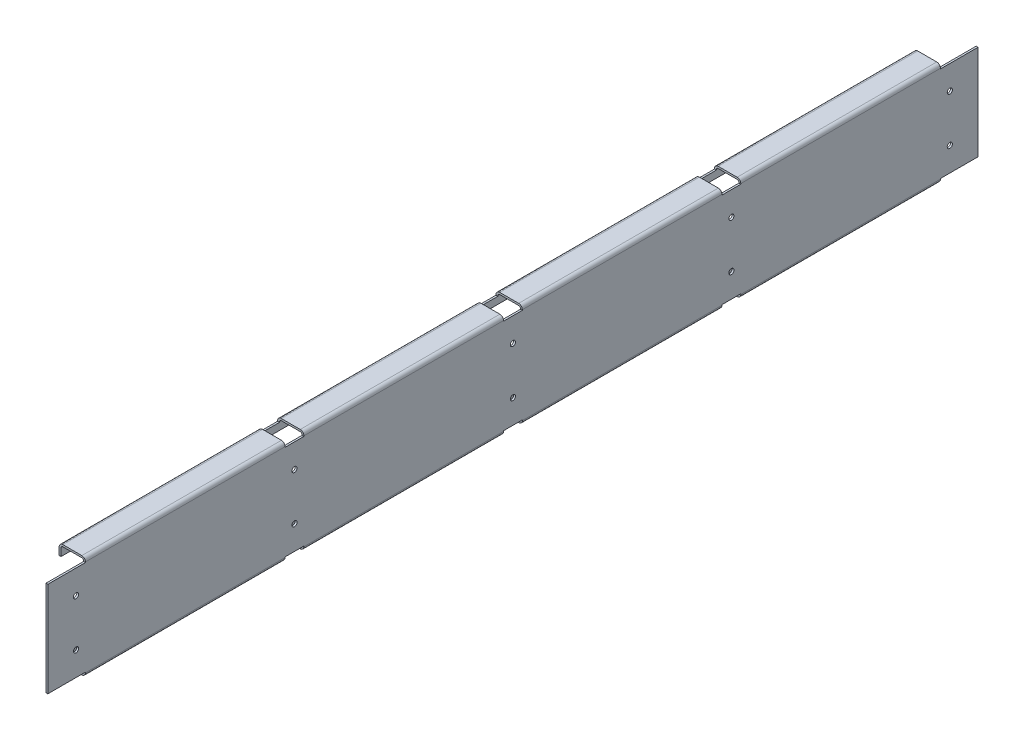
from build123d import *

# Parameters (mm, degrees)
BASE_FLANGE1_DEPTH      = 495
SKETCH6_W               = 30.5
SKETCH6_H               = 20
CUT_EXTRUDE1_DEPTH      = 4.5
LPATTERN1_COUNT         = 3
LPATTERN1_PITCH         = 232.5
LPATTERN1_COL_COUNT     = 3
LPATTERN1_COL_PITCH     = 232.5
MIRROR1_COPY_1_SKETCH_W = 30.5
MIRROR1_COPY_1_SKETCH_H = 20
MIRROR1_COPY_1_DEPTH    = 4.5
MIRROR1_COPY_2_SKETCH_W = 30.5
MIRROR1_COPY_2_SKETCH_H = 20
MIRROR1_COPY_2_DEPTH    = 4.5
MIRROR1_COPY_3_SKETCH_W = 30.5
MIRROR1_COPY_3_SKETCH_H = 20
MIRROR1_COPY_3_DEPTH    = 4.5
MIRROR1_COPY_4_SKETCH_W = 30.5
MIRROR1_COPY_4_SKETCH_H = 20
MIRROR1_COPY_4_DEPTH    = 4.5
CUT_EXTRUDE2_START      = -26
SKETCH7_W               = 40
SKETCH7_H               = 110
CUT_EXTRUDE2_DEPTH      = 26
SKETCH8_W               = 28.862585434
SKETCH8_H               = 32.444228354
SKETCH8_W_2             = 23.227575409
SKETCH8_H_2             = 8.085236505
CUT_EXTRUDE3_DEPTH      = 4.5
CUT_EXTRUDE4_START      = -26
SKETCH9_W               = 93.672664124
SKETCH9_H               = 132.08314216
CUT_EXTRUDE4_DEPTH      = 26
SKETCH10_W              = 25.364032915
SKETCH10_H              = 10.922603619
SKETCH10_W_2            = 22.654683255
SKETCH10_H_2            = 8.37911004
CUT_EXTRUDE5_DEPTH      = 4.5
SKETCH11_R              = 2.75
CUT_EXTRUDE6_DEPTH      = 499.832637264
LPATTERN2_COUNT         = 3
LPATTERN2_PITCH         = 232.5
LPATTERN2_COL_COUNT     = 3
LPATTERN2_COL_PITCH     = 232.5


# Sheet-metal steps are written as plain solids
with BuildPart() as part:
    # Sketch1 → Base-Flange1 (new, symmetric)
    with BuildSketch(Plane.XY):
        with BuildLine():
            Line((-28, -43), (-28, -51.1))
            ThreePointArc((-28, -51.1), (-26.857716447, -53.857716447), (-24.1, -55))
            Line((-24.1, -55), (-3.9, -55))
            ThreePointArc((-3.9, -55), (-1.142283553, -53.857716447), (0, -51.1))
            Line((0, -51.1), (0, 51.1))
            ThreePointArc((0, 51.1), (-1.142283553, 53.857716447), (-3.9, 55))
            Line((-3.9, 55), (-24.1, 55))
            ThreePointArc((-24.1, 55), (-26.857716447, 53.857716447), (-28, 51.1))
            Line((-28, 51.1), (-28, 43))
            Line((-28, 43), (-26, 43))
            Line((-26, 43), (-26, 51.1))
            ThreePointArc((-26, 51.1), (-25.443502884, 52.443502884), (-24.1, 53))
            Line((-24.1, 53), (-3.9, 53))
            ThreePointArc((-3.9, 53), (-2.556497116, 52.443502884), (-2, 51.1))
            Line((-2, 51.1), (-2, -51.1))
            ThreePointArc((-2, -51.1), (-2.556497116, -52.443502884), (-3.9, -53))
            Line((-3.9, -53), (-24.1, -53))
            ThreePointArc((-24.1, -53), (-25.443502884, -52.443502884), (-26, -51.1))
            Line((-26, -51.1), (-26, -43))
            Line((-26, -43), (-28, -43))
        make_face()
    extrude(amount=BASE_FLANGE1_DEPTH, both=True)

    # Sketch6 → Cut-Extrude1 (cut)
    with BuildSketch(Plane(origin=(0, 55, 0), x_dir=(1, 0, 0), z_dir=(0, 1, 0))):
        with Locations((-14, 0)):
            Rectangle(SKETCH6_W, SKETCH6_H)
    cut_extrude1 = extrude(amount=-CUT_EXTRUDE1_DEPTH, mode=Mode.SUBTRACT)

    # LPattern1: Cut-Extrude1 ×3
    with Locations(*[(0, 0, -i * LPATTERN1_PITCH) for i in range(1, LPATTERN1_COUNT)]):
        add(cut_extrude1, mode=Mode.SUBTRACT)

    # LPattern1 col: Cut-Extrude1 ×3
    with Locations(*[(0, 0, i * LPATTERN1_COL_PITCH) for i in range(1, LPATTERN1_COL_COUNT)]):
        add(cut_extrude1, mode=Mode.SUBTRACT)

    # Mirror1: Cut-Extrude1 across plane
    add(cut_extrude1.mirror(Plane.ZX), mode=Mode.SUBTRACT)

    # Mirror1 copy 1 sketch → Mirror1 copy 1 (cut)
    with BuildSketch(Plane(origin=(0, -55, -232.5), x_dir=(1, 0, 0), z_dir=(0, -1, 0))):
        with Locations((-14, 0)):
            Rectangle(MIRROR1_COPY_1_SKETCH_W, MIRROR1_COPY_1_SKETCH_H)
    extrude(amount=-MIRROR1_COPY_1_DEPTH, mode=Mode.SUBTRACT)

    # Mirror1 copy 2 sketch → Mirror1 copy 2 (cut)
    with BuildSketch(Plane(origin=(0, -55, -465), x_dir=(1, 0, 0), z_dir=(0, -1, 0))):
        with Locations((-14, 0)):
            Rectangle(MIRROR1_COPY_2_SKETCH_W, MIRROR1_COPY_2_SKETCH_H)
    extrude(amount=-MIRROR1_COPY_2_DEPTH, mode=Mode.SUBTRACT)

    # Mirror1 copy 3 sketch → Mirror1 copy 3 (cut)
    with BuildSketch(Plane(origin=(0, -55, 232.5), x_dir=(1, 0, 0), z_dir=(0, -1, 0))):
        with Locations((-14, 0)):
            Rectangle(MIRROR1_COPY_3_SKETCH_W, MIRROR1_COPY_3_SKETCH_H)
    extrude(amount=-MIRROR1_COPY_3_DEPTH, mode=Mode.SUBTRACT)

    # Mirror1 copy 4 sketch → Mirror1 copy 4 (cut)
    with BuildSketch(Plane(origin=(0, -55, 465), x_dir=(1, 0, 0), z_dir=(0, -1, 0))):
        with Locations((-14, 0)):
            Rectangle(MIRROR1_COPY_4_SKETCH_W, MIRROR1_COPY_4_SKETCH_H)
    extrude(amount=-MIRROR1_COPY_4_DEPTH, mode=Mode.SUBTRACT)

    # Sketch7 → Cut-Extrude2 (cut)
    with BuildSketch(Plane.ZY.offset(28).offset(CUT_EXTRUDE2_START)):
        with Locations((475, 0)):
            Rectangle(SKETCH7_W, SKETCH7_H)
    extrude(amount=CUT_EXTRUDE2_DEPTH, mode=Mode.SUBTRACT)

    # Sketch8 → Cut-Extrude3 (cut)
    with BuildSketch(Plane(origin=(0, 0, 0), x_dir=(0, 0, -1), z_dir=(1, 0, 0))):
        with Locations((-489.431292717, -66.722114177)):
            Rectangle(SKETCH8_W, SKETCH8_H)
        with Locations((-486.613787705, 54.542618253)):
            Rectangle(SKETCH8_W_2, SKETCH8_H_2)
    extrude(amount=-CUT_EXTRUDE3_DEPTH, mode=Mode.SUBTRACT)

    # Sketch9 → Cut-Extrude4 (cut)
    with BuildSketch(Plane.ZY.offset(28).offset(CUT_EXTRUDE4_START)):
        with Locations((-501.836332062, -11.04157108)):
            Rectangle(SKETCH9_W, SKETCH9_H)
    extrude(amount=CUT_EXTRUDE4_DEPTH, mode=Mode.SUBTRACT)

    # Sketch10 → Cut-Extrude5 (cut)
    with BuildSketch(Plane(origin=(0, 0, 0), x_dir=(0, 0, -1), z_dir=(1, 0, 0))):
        with Locations((487.682016458, -55.96130181)):
            Rectangle(SKETCH10_W, SKETCH10_H)
        with Locations((486.327341628, 54.68955502)):
            Rectangle(SKETCH10_W_2, SKETCH10_H_2)
    extrude(amount=-CUT_EXTRUDE5_DEPTH, mode=Mode.SUBTRACT)

    # Sketch11 → Cut-Extrude6 (cut, through all)
    with BuildSketch(Plane(origin=(0, 0, 0), x_dir=(0, 0, -1), z_dir=(1, 0, 0))):
        with Locations(Location((0, -25, 0), (0, 0, 90))):
            Circle(SKETCH11_R)
        with Locations(Location((0, 25, 0), (0, 0, 90))):
            Circle(SKETCH11_R)
    cut_extrude6 = extrude(amount=-CUT_EXTRUDE6_DEPTH, mode=Mode.SUBTRACT)

    # LPattern2: Cut-Extrude6 ×3
    with Locations(*[(0, 0, -i * LPATTERN2_PITCH) for i in range(1, LPATTERN2_COUNT)]):
        add(cut_extrude6, mode=Mode.SUBTRACT)

    # LPattern2 col: Cut-Extrude6 ×3
    with Locations(*[(0, 0, i * LPATTERN2_COL_PITCH) for i in range(1, LPATTERN2_COL_COUNT)]):
        add(cut_extrude6, mode=Mode.SUBTRACT)


solid = part.part
